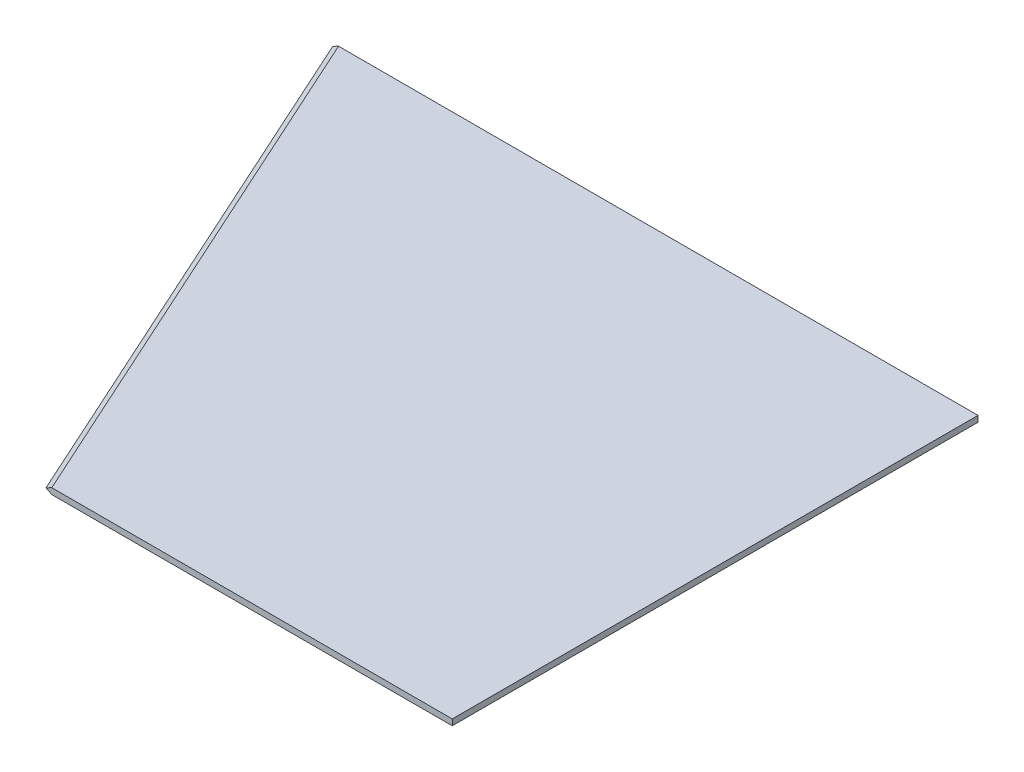
from build123d import *

# Parameters (mm, degrees)
BOSS_EXTRUDE1_DEPTH = 1
CHAMFER1_SIZE       = 1.76
CHAMFER1_SIZE2      = 1
CHAMFER2_SIZE2      = 1.76
CHAMFER2_SIZE       = 1


with BuildPart() as part:
    # Sketch1 → Boss-Extrude1 (new, symmetric)
    with BuildSketch(Plane(origin=(0, 0, 0), x_dir=(1, 0, 0), z_dir=(0, 1, 0))):
        Polygon((0, 0), (216, 0), (216, -176), (80, -176), align=None)
    extrude(amount=BOSS_EXTRUDE1_DEPTH, both=True)

    # Chamfer1
    chamfer1_edges = [part.edges().sort_by_distance(p)[0] for p in [
        (40, -1, 88),
    ]]
    chamfer1_side = [part.faces().sort_by_distance(p)[0] for p in [
        (126.484848485, -1, 81.333333333),
    ]]
    chamfer(chamfer1_edges, length=CHAMFER1_SIZE, length2=CHAMFER1_SIZE2, reference=chamfer1_side[0])

    # Chamfer2
    chamfer2_edges = [part.edges().sort_by_distance(p)[0] for p in [
        (40, 1, 88),
    ]]
    chamfer2_side = [part.faces().sort_by_distance(p)[0] for p in [
        (40, 0.98, 88),
    ]]
    chamfer(chamfer2_edges, length=CHAMFER2_SIZE - 0.0001, length2=CHAMFER2_SIZE2 - 0.0001, reference=chamfer2_side[0])  # a hair under: the kernel refuses the full size


solid = part.part
